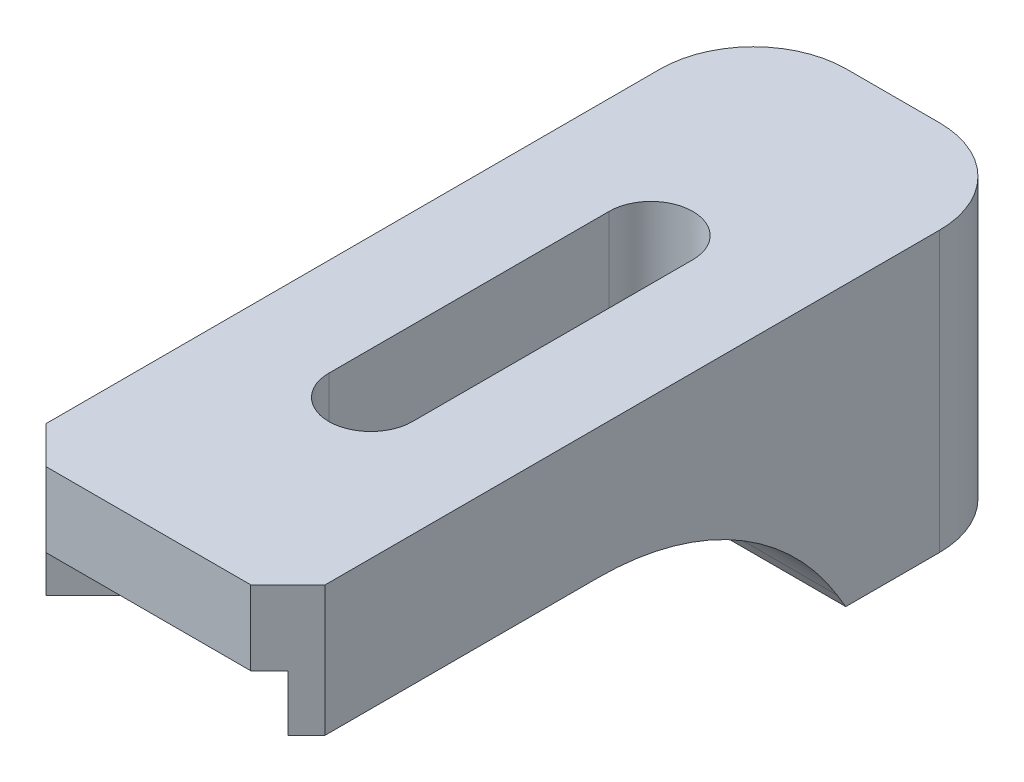
from build123d import *

# Parameters (mm, degrees)
SKETCH1_W           = 15
SKETCH1_H           = 40
BOSS_EXTRUDE1_DEPTH = 15
CUT_EXTRUDE1_DEPTH  = 30.154759474
FILLET1_R           = 15
CUT_EXTRUDE2_DEPTH  = 3
FILLET2_R           = 0.5
FILLET4_R           = 0.5
CHAMFER1_SIZE       = 2
FILLET6_R           = 5
CUT_EXTRUDE3_DEPTH  = 27.100766272


with BuildPart() as part:
    # Sketch1 → Boss-Extrude1 (new body)
    with BuildSketch(Plane(origin=(0, 0, 0), x_dir=(1, 0, 0), z_dir=(0, 1, 0))):
        Rectangle(SKETCH1_W, SKETCH1_H)
    extrude(amount=BOSS_EXTRUDE1_DEPTH)

    # Sketch3 → Cut-Extrude1 (cut, through all)
    with BuildSketch(Plane.ZY.offset(7.5)):
        Polygon((20, 0), (20, 8), (-5.121506718, 8), (-9.96820088, 0), align=None)
    extrude(amount=-CUT_EXTRUDE1_DEPTH, mode=Mode.SUBTRACT)

    # Fillet1
    fillet1_edges = [part.edges().sort_by_distance(p)[0] for p in [
        (0, 8, -5.121506718),
    ]]
    fillet(fillet1_edges, radius=FILLET1_R)

    # Sketch5 → Cut-Extrude2 (cut)
    with BuildSketch(Plane.XZ.offset(-8)):
        with BuildLine():
            Line((7.5, 20), (0.681678783, 13.181678783))
            ThreePointArc((0.681678783, 13.181678783), (0, 11.53596062), (-0.681678783, 13.181678783))
            Line((-0.681678783, 13.181678783), (-7.5, 20))
            Line((-7.5, 20), (7.5, 20))
        make_face()
    extrude(amount=-CUT_EXTRUDE2_DEPTH, mode=Mode.SUBTRACT)

    # Fillet2
    fillet2_edges = [part.edges().sort_by_distance(p)[0] for p in [
        (0.681678783, 9.5, 13.181678783),
        (-0.681678783, 9.5, 13.181678783),
    ]]
    fillet(fillet2_edges, radius=FILLET2_R)

    # Fillet4
    fillet4_edges = [part.edges().sort_by_distance(p)[0] for p in [
        (-7.5, 9.5, 20),
        (7.5, 9.5, 20),
    ]]
    fillet(fillet4_edges, radius=FILLET4_R)

    # Chamfer1
    # the kernel refuses this chamfer: 2 mm, written as the material it takes off along each edge
    with BuildSketch(Plane(origin=(7.5, 5.856634024, 20), x_dir=(0.02749587661058651, 0, -0.9996219169112968), z_dir=(0, 1, 0))) as chamfer1_piece_1:
        Polygon((CHAMFER1_SIZE * 0.999621916911, CHAMFER1_SIZE * 0.0274958766106), (-CHAMFER1_SIZE * 0.0274958766106, CHAMFER1_SIZE * 0.999621916911), (0, 0), align=None)
    extrude(amount=14.286731952, mode=Mode.SUBTRACT)
    with BuildSketch(Plane(origin=(-7.5, 5.856634024, 20), x_dir=(-0.02749587661058651, 0, -0.9996219169112968), z_dir=(0, 1, 0))) as chamfer1_piece_2:
        Polygon((CHAMFER1_SIZE * 0.999621916911, -CHAMFER1_SIZE * 0.0274958766106), (-CHAMFER1_SIZE * 0.0274958766106, -CHAMFER1_SIZE * 0.999621916911), (0, 0), align=None)
    extrude(amount=14.286731952, mode=Mode.SUBTRACT)

    # Fillet6
    fillet6_edges = [part.edges().sort_by_distance(p)[0] for p in [
        (-7.5, 7.5, -20),
        (7.5, 7.5, -20),
    ]]
    fillet(fillet6_edges, radius=FILLET6_R)

    # Sketch6 → Cut-Extrude3 (cut, through all)
    with BuildSketch(Plane(origin=(0, 15, 0), x_dir=(1, 0, 0), z_dir=(0, 1, 0))):
        with BuildLine():
            Line((-2.25, 7), (-2.25, -8.056468678))
            ThreePointArc((-2.25, -8.056468678), (0, -10.306468678), (2.25, -8.056468678))
            Line((2.25, -8.056468678), (2.25, 7))
            ThreePointArc((2.25, 7), (0, 9.25), (-2.25, 7))
        make_face()
    extrude(amount=-CUT_EXTRUDE3_DEPTH, mode=Mode.SUBTRACT)


solid = part.part
